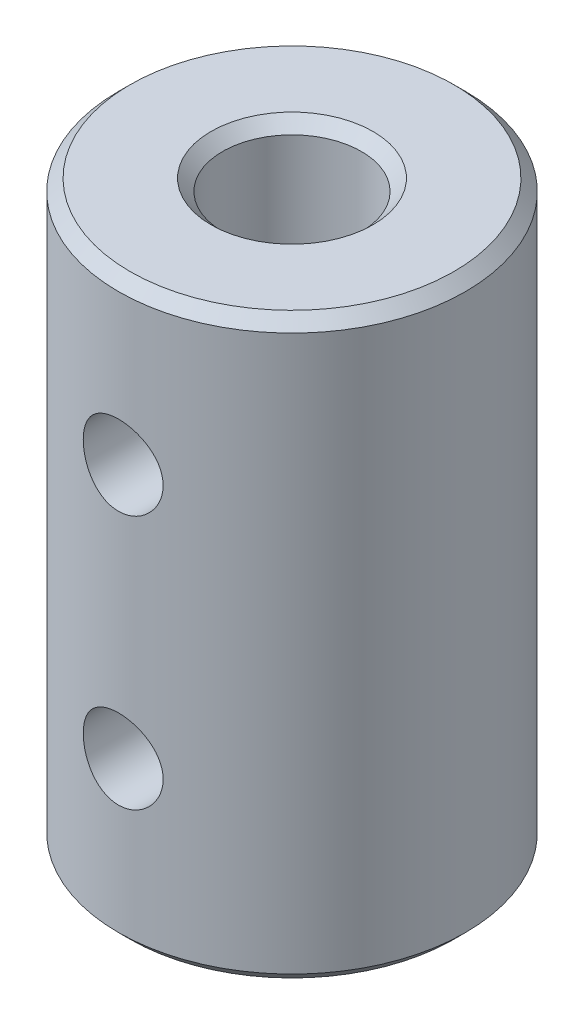
from build123d import *

# Parameters (mm, degrees)
SKETCH1_R                 = 7.5
SKETCH1_R_2               = 3
BOSS_EXTRUDE1_DEPTH       = 25
CHAMFER1_SIZE             = 0.5
F_8_32_TAPPED_HOLE1_D     = 3.4544
F_8_32_TAPPED_HOLE1_DEPTH = 18
F_8_32_TAPPED_HOLE1_TIP   = 1.037806461


with BuildPart() as part:
    # Sketch1 → Boss-Extrude1 (new body)
    with BuildSketch(Plane(origin=(0, 0, 0), x_dir=(1, 0, 0), z_dir=(0, 1, 0))):
        Circle(SKETCH1_R)
        Circle(SKETCH1_R_2, mode=Mode.SUBTRACT)
    extrude(amount=BOSS_EXTRUDE1_DEPTH)

    # Chamfer1
    chamfer1_edges = [part.edges().sort_by_distance(p)[0] for p in [
        (-3, 0, 0),
        (-7.5, 0, 0),
        (-3, 25, 0),
        (-7.5, 25, 0),
    ]]
    chamfer(chamfer1_edges, length=CHAMFER1_SIZE)

    # #8-32 Tapped Hole1
    with Locations(Plane.XY.offset(19.05)):
        with Locations((0, 18), (0, 7)):
            Hole(F_8_32_TAPPED_HOLE1_D / 2, depth=F_8_32_TAPPED_HOLE1_DEPTH)
            with Locations((0, 0, -(F_8_32_TAPPED_HOLE1_DEPTH + F_8_32_TAPPED_HOLE1_TIP / 2))):  # 118° drill point
                Cone(0, F_8_32_TAPPED_HOLE1_D / 2, F_8_32_TAPPED_HOLE1_TIP, mode=Mode.SUBTRACT)


solid = part.part
